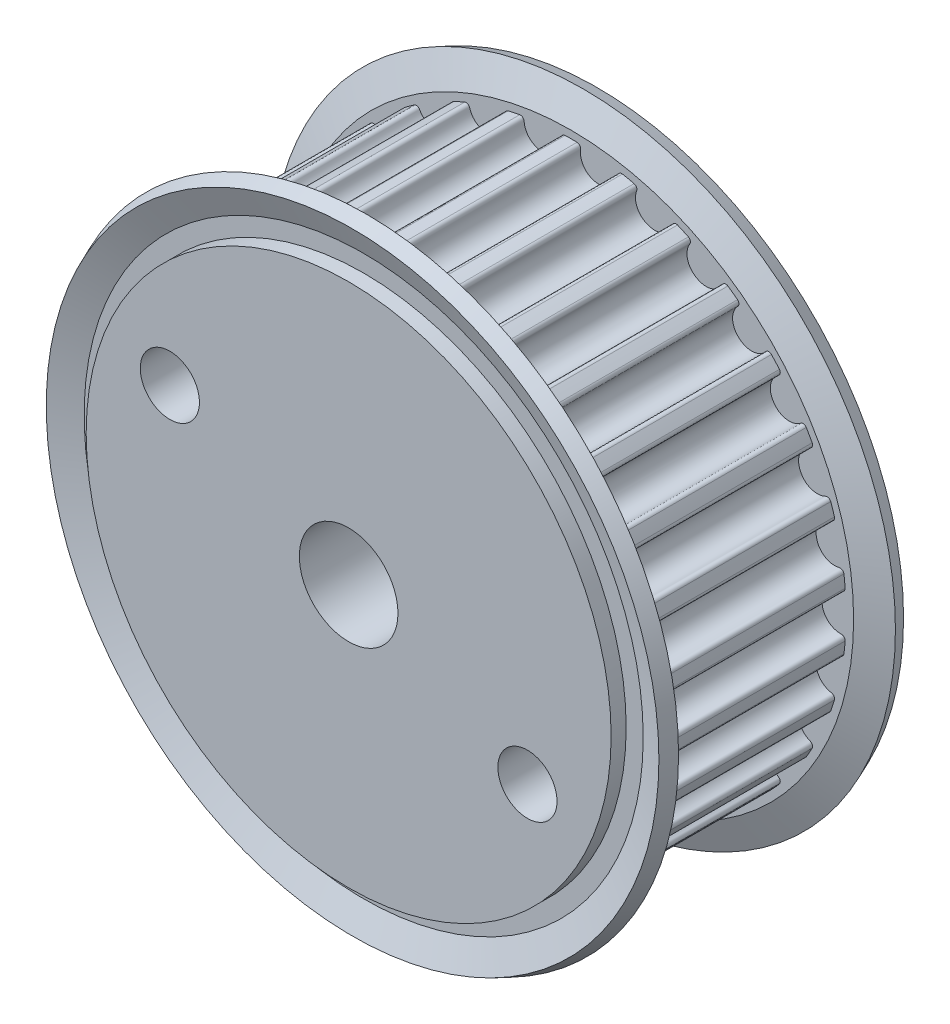
from build123d import *

# Parameters (mm, degrees)
TOOTHEXTRUDECUTGEARBELT01_DEPTH = 4.876799927
PATTERNGEARBELT01_COUNT         = 30
BOREREVOLVESKETCH_W             = 12.801599808
BOREREVOLVESKETCH_H             = 2.5
SKETCH_1_R                      = 1.500000001
CUT_EXTRUDE_1_DEPTH             = 17


with BuildPart() as part:
    # SketchRevolveGearBelt01 → GearBelt01 (revolve)
    with BuildSketch(Plane(origin=(0, 0, 0), x_dir=(0, 0, -1), z_dir=(1, 0, 0))):
        Polygon((6.400799904, 0), (6.400799904, 13.306916417), (5.638799915, 13.306916417), (5.638799915, 14.17134518), (6.201536555, 15.529911608), (5.497540362, 15.821516379), (4.876799927, 14.322916402), (4.876799927, 13.941916408), (-4.876799927, 13.941916408), (-4.876799927, 14.322916402), (-5.497540362, 15.821516379), (-6.201536555, 15.529911608), (-5.638799915, 14.17134518), (-5.638799915, 13.306916417), (-6.400799904, 13.306916417), (-6.400799904, 0), align=None)
    revolve(axis=Axis((0, 0, 0), (0, 0, -1)))

    # SketchToothGearBelt01 → ToothExtrudeCutGearBelt01 (cut, symmetric)
    with BuildSketch(Plane.XY):
        with BuildLine():
            ThreePointArc((13.893477895, 1.162049767), (13.941990091, 0), (13.893477895, -1.162049767))
            add(Edge.make_bspline(
                [(13.893477895, -1.162049767), (13.894355497, -1.151569871), (13.894367328, -1.13574137), (13.891783851, -1.114849561), (13.88856033, -1.099393952), (13.884072736, -1.084256956), (13.878351699, -1.069541767), (13.871436211, -1.055348702), (13.863373419, -1.041774518), (13.854218288, -1.028911755), (13.844033233, -1.016848102), (13.832887687, -1.005665799), (13.820857633, -0.995441086), (13.808025082, -0.986243636), (13.794477517, -0.97813627), (13.780307299, -0.971173811), (13.765611019, -0.965405397), (13.750488906, -0.960864109), (13.735043897, -0.957604207), (13.719381867, -0.955560951), (13.690295039, -0.954660893), (13.642257342, -0.955570539), (13.575220239, -0.952960995), (13.502997829, -0.944194093), (13.431675895, -0.929863568), (13.361697972, -0.909971895), (13.293492773, -0.884664268), (13.227479874, -0.85409009), (13.164064907, -0.818438922), (13.10363766, -0.777929443), (13.046569525, -0.732810753), (12.993211261, -0.683360129), (12.943890814, -0.629881514), (12.898911329, -0.572703598), (12.858549229, -0.512177812), (12.823052703, -0.448676153), (12.792639493, -0.382588943), (12.767498123, -0.314322274), (12.747777154, -0.244296081), (12.733620052, -0.172939446), (12.725030771, -0.100695851), (12.723087585, -0.04755736), (12.723178891, -0.014000083), (12.723166194, 0), (12.723178891, 0.014000083), (12.723087585, 0.04755736), (12.725030771, 0.100695851), (12.733620052, 0.172939446), (12.747777154, 0.244296081), (12.767498123, 0.314322274), (12.792639493, 0.382588943), (12.823052703, 0.448676153), (12.858549229, 0.512177812), (12.898911329, 0.572703598), (12.943890814, 0.629881514), (12.993211261, 0.683360129), (13.046569525, 0.732810753), (13.10363766, 0.777929443), (13.164064907, 0.818438922), (13.227479874, 0.85409009), (13.293492773, 0.884664268), (13.361697972, 0.909971895), (13.431675895, 0.929863568), (13.502997829, 0.944194093), (13.575220239, 0.952960995), (13.642257342, 0.955570539), (13.690295039, 0.954660893), (13.719381867, 0.955560951), (13.735043897, 0.957604207), (13.750488906, 0.960864109), (13.765611019, 0.965405397), (13.780307299, 0.971173811), (13.794477517, 0.97813627), (13.808025082, 0.986243636), (13.820857633, 0.995441086), (13.832887687, 1.005665799), (13.844033233, 1.016848102), (13.854218288, 1.028911755), (13.863373419, 1.041774518), (13.871436211, 1.055348702), (13.878351699, 1.069541767), (13.884072736, 1.084256956), (13.88856033, 1.099393952), (13.891783851, 1.114849561), (13.894367328, 1.13574137), (13.894355497, 1.151569871), (13.893477895, 1.162049767)],
                knots=[0, 0, 0, 0, 0.008512506, 0.012768759, 0.017025012, 0.021281265, 0.025537518, 0.029793771, 0.034050023, 0.038306276, 0.042562529, 0.046818782, 0.051075035, 0.055331288, 0.059587541, 0.063843794, 0.068100047, 0.0723563, 0.076612553, 0.080868806, 0.085125059, 0.100157118, 0.119771414, 0.139385711, 0.159000007, 0.178614304, 0.1982286, 0.217842897, 0.237457193, 0.257071489, 0.276685786, 0.296300082, 0.315914379, 0.335528675, 0.355142972, 0.374757268, 0.394371565, 0.413985861, 0.433600158, 0.453214454, 0.472828751, 0.492443047, 0.496221523, 0.5, 0.503778477, 0.507556953, 0.527171249, 0.546785546, 0.566399842, 0.586014139, 0.605628435, 0.625242732, 0.644857028, 0.664471325, 0.684085621, 0.703699918, 0.723314214, 0.742928511, 0.762542807, 0.782157103, 0.8017714, 0.821385696, 0.840999993, 0.860614289, 0.880228586, 0.899842882, 0.914874941, 0.919131194, 0.923387447, 0.9276437, 0.931899953, 0.936156206, 0.940412459, 0.944668712, 0.948924965, 0.953181218, 0.957437471, 0.961693724, 0.965949977, 0.970206229, 0.974462482, 0.978718735, 0.982974988, 0.987231241, 0.991487494, 1, 1, 1, 1], degree=3))
        make_face()
    toothextrudecutgearbelt01 = extrude(amount=TOOTHEXTRUDECUTGEARBELT01_DEPTH, both=True, mode=Mode.SUBTRACT)

    # PatternGearBelt01: ToothExtrudeCutGearBelt01 ×30 about axis
    patterngearbelt01_axis = Axis((0, 0, 55), (0, 0, -1))
    for i in range(1, PATTERNGEARBELT01_COUNT):
        add(toothextrudecutgearbelt01.rotate(patterngearbelt01_axis, i * 360 / PATTERNGEARBELT01_COUNT), mode=Mode.SUBTRACT)

    # BoreRevolveSketch → BoreRevolveCut (revolve, cut)
    with BuildSketch(Plane(origin=(0, 0, 0), x_dir=(0, 0, -1), z_dir=(1, 0, 0))):
        with Locations((0, 1.25)):
            Rectangle(BOREREVOLVESKETCH_W, BOREREVOLVESKETCH_H)
    revolve(axis=Axis((0, 0, 0), (0, 0, -1)), mode=Mode.SUBTRACT)

    # 草图1 → 切除-拉伸1 (cut)
    with BuildSketch(Plane(origin=(0, 0, -6.400799904), x_dir=(-1, 0, 0), z_dir=(0, 0, -1))):
        with Locations((-9.063783719, -4.224668589)):
            Circle(SKETCH_1_R)
        with Locations((9.063783719, 4.224668589)):
            Circle(SKETCH_1_R)
    extrude(amount=-CUT_EXTRUDE_1_DEPTH, mode=Mode.SUBTRACT)


solid = part.part
